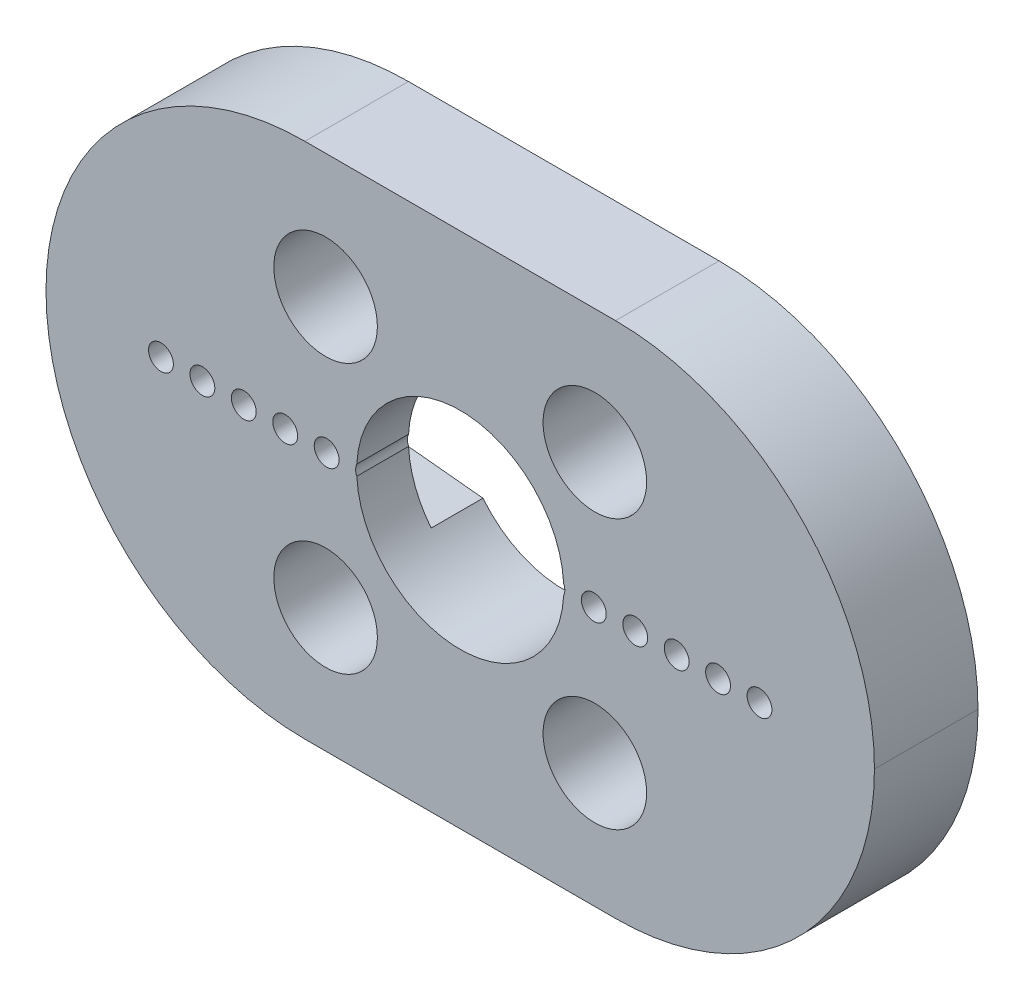
from build123d import *

# Parameters (mm, degrees)
SKETCH1_W              = 40
SKETCH1_H              = 25
BOSS_EXTRUDE2_DEPTH    = 5
CUT_EXTRUDE1_DEPTH     = 2.5
CUT_EXTRUDE2_START     = -2.5
CUT_EXTRUDE2_OUTLINE_R = 0.6
CUT_EXTRUDE2_DEPTH     = 2.5
SKETCH7_R              = 5
CUT_EXTRUDE3_DEPTH     = 25.109126902
SKETCH8_R              = 2.5
CUT_EXTRUDE4_DEPTH     = 25.109126902
FILLET1_R              = 12.5


# Read off the part's stored shape, not the designer's step: Cut-Extrude2
with BuildPart() as part:
    # Sketch1 → Boss-Extrude2 (new body)
    with BuildSketch(Plane.XY):
        Rectangle(SKETCH1_W, SKETCH1_H)
    extrude(amount=BOSS_EXTRUDE2_DEPTH)

    # Sketch4 → Cut-Extrude1 (cut)
    with BuildSketch(Plane(origin=(0, 0, 0), x_dir=(-1, 0, 0), z_dir=(0, 0, -1))):
        with BuildLine():
            Line((-0.35, 3.48245603), (-15.2, 1.989974874))
            ThreePointArc((-15.2, 1.989974874), (-17, 0), (-15.2, -1.989974874))
            Line((-15.2, -1.989974874), (-0.35, -3.48245603))
            ThreePointArc((-0.35, -3.48245603), (0, -3.5), (0.35, -3.48245603))
            Line((0.35, -3.48245603), (15.2, -1.989974874))
            ThreePointArc((15.2, -1.989974874), (17, 0), (15.2, 1.989974874))
            Line((15.2, 1.989974874), (0.35, 3.48245603))
            ThreePointArc((0.35, 3.48245603), (0, 3.5), (-0.35, 3.48245603))
        make_face()
    extrude(amount=-CUT_EXTRUDE1_DEPTH, mode=Mode.SUBTRACT)

    # Cut-Extrude2 outline → Cut-Extrude2 (cut)
    with BuildSketch(Plane(origin=(0, 0, 2.5), x_dir=(-1, 0, 0), z_dir=(0, 0, -1)).offset(CUT_EXTRUDE2_START)):
        with BuildLine():
            ThreePointArc((3.982303371, 0.375845531), (4, 0), (3.982303371, -0.375845531))
            ThreePointArc((3.982303371, -0.375845531), (5.05, 0), (3.982303371, 0.375845531))
        make_face()
        with Locations((-4.45, 0)):
            Circle(CUT_EXTRUDE2_OUTLINE_R)
        with Locations((-6.45, 0)):
            Circle(CUT_EXTRUDE2_OUTLINE_R)
        with Locations((-8.45, 0)):
            Circle(CUT_EXTRUDE2_OUTLINE_R)
        with Locations((-14.45, 0)):
            Circle(CUT_EXTRUDE2_OUTLINE_R)
        with Locations((8.45, 0)):
            Circle(CUT_EXTRUDE2_OUTLINE_R)
        with Locations((10.45, 0)):
            Circle(CUT_EXTRUDE2_OUTLINE_R)
        with Locations((12.45, 0)):
            Circle(CUT_EXTRUDE2_OUTLINE_R)
        with Locations((14.45, 0)):
            Circle(CUT_EXTRUDE2_OUTLINE_R)
        with Locations((-12.45, 0)):
            Circle(CUT_EXTRUDE2_OUTLINE_R)
        with Locations((-10.45, 0)):
            Circle(CUT_EXTRUDE2_OUTLINE_R)
        with Locations((6.45, 0)):
            Circle(CUT_EXTRUDE2_OUTLINE_R)
    extrude(amount=CUT_EXTRUDE2_DEPTH, mode=Mode.SUBTRACT)

    # Sketch7 → Cut-Extrude3 (cut, through all)
    with BuildSketch(Plane(origin=(0, 0, 0), x_dir=(-1, 0, 0), z_dir=(0, 0, -1))):
        Circle(SKETCH7_R)
    extrude(amount=-CUT_EXTRUDE3_DEPTH, mode=Mode.SUBTRACT)

    # Sketch8 → Cut-Extrude4 (cut, through all)
    with BuildSketch(Plane.XY.offset(5)):
        with Locations((6.5, 6.5)):
            Circle(SKETCH8_R)
        with Locations((-6.5, 6.5)):
            Circle(SKETCH8_R)
        with Locations((-6.5, -6.5)):
            Circle(SKETCH8_R)
        with Locations((6.5, -6.5)):
            Circle(SKETCH8_R)
    extrude(amount=-CUT_EXTRUDE4_DEPTH, mode=Mode.SUBTRACT)

    # Fillet1
    fillet1_edges = [part.edges().sort_by_distance(p)[0] for p in [
        (-20, 12.5, 2.5),
        (-20, -12.5, 2.5),
        (20, -12.5, 2.5),
        (20, 12.5, 2.5),
    ]]
    fillet(fillet1_edges, radius=FILLET1_R - 0.0001)  # a hair under: the kernel refuses the full size


solid = part.part
